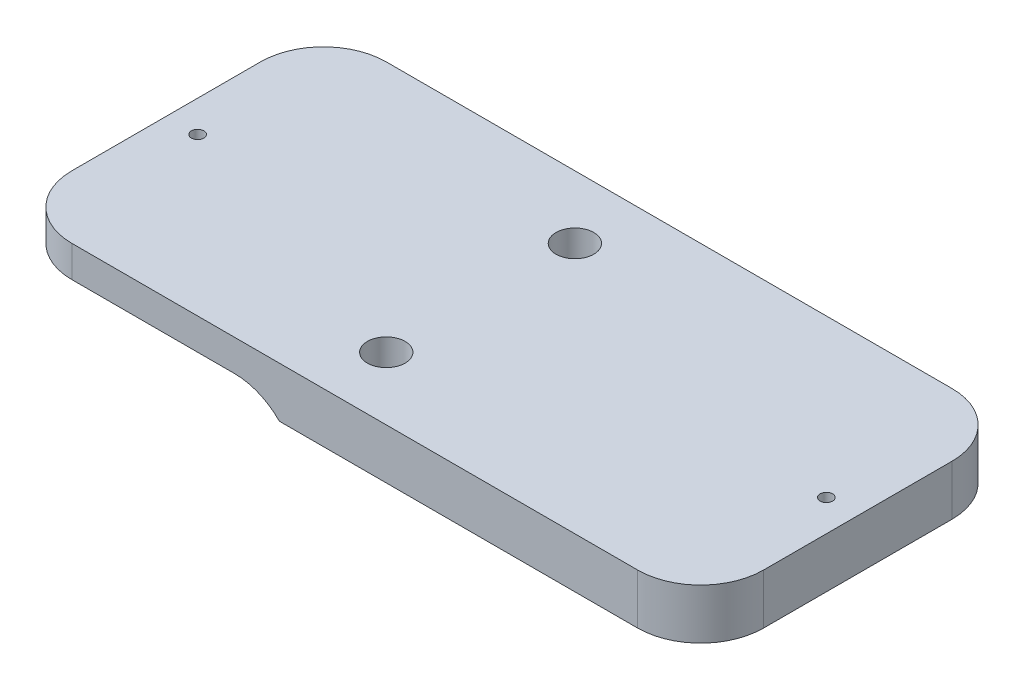
from build123d import *

# Parameters (mm, degrees)
SKETCH1_W           = 110
SKETCH1_H           = 50
SKETCH1_R           = 1.75
BOSS_EXTRUDE1_DEPTH = 8
SKETCH2_W           = 43
SKETCH2_H           = 50
CUT_EXTRUDE1_DEPTH  = 3
SKETCH3_R           = 3
CUT_EXTRUDE2_DEPTH  = 5
FILLET1_R           = 10
FILLET2_R           = 10
SKETCH4_R           = 1
CUT_EXTRUDE3_DEPTH  = 122.095004026


with BuildPart() as part:
    # Sketch1 → Boss-Extrude1 (new body)
    with BuildSketch(Plane(origin=(0, 0, 0), x_dir=(1, 0, 0), z_dir=(0, 1, 0))):
        with Locations((55, 25)):
            Rectangle(SKETCH1_W, SKETCH1_H)
        with Locations(Location((50, 40, 0), (0, 0, 270))):
            Circle(SKETCH1_R, mode=Mode.SUBTRACT)
        with Locations(Location((50, 10, 0), (0, 0, 270))):
            Circle(SKETCH1_R, mode=Mode.SUBTRACT)
    extrude(amount=BOSS_EXTRUDE1_DEPTH)

    # Sketch2 → Cut-Extrude1 (cut)
    with BuildSketch(Plane.XZ):
        with Locations((21.5, -25)):
            Rectangle(SKETCH2_W, SKETCH2_H)
    extrude(amount=-CUT_EXTRUDE1_DEPTH, mode=Mode.SUBTRACT)

    # Sketch3 → Cut-Extrude2 (cut)
    with BuildSketch(Plane(origin=(0, 8, 0), x_dir=(1, 0, 0), z_dir=(0, 1, 0))):
        with Locations(Location((50, 40, 0), (0, 0, 270))):
            Circle(SKETCH3_R)
        with Locations(Location((50, 10, 0), (0, 0, 270))):
            Circle(SKETCH3_R)
    extrude(amount=-CUT_EXTRUDE2_DEPTH, mode=Mode.SUBTRACT)

    # Fillet1
    # the kernel refuses this fillet: 10 mm, written as the material it adds along each edge
    with BuildSketch(Plane(origin=(43, 3, 0), x_dir=(-1, 0, 0), z_dir=(0, 0, -1))) as fillet1_piece_1:
        with BuildLine():
            CenterArc((7.141428429, -10), FILLET1_R, 90, 45.572995999)
            Line((0, -3), (-0.142828569, -2.86))
            ThreePointArc((-0.142828569, -2.86), (-0.2, -1.5), (-0.2, 0))
            Line((-0.2, 0), (0, 0.2))
            Line((0, 0.2), (7.141428429, 0.2))
            Line((7.141428429, 0.2), (7.141428429, 0))
        make_face()
    extrude(amount=50)

    # Fillet2
    fillet2_edges = [part.edges().sort_by_distance(p)[0] for p in [
        (0, 5.5, -50),
        (110, 4, -50),
        (110, 4, 0),
        (0, 5.5, 0),
    ]]
    fillet(fillet2_edges, radius=FILLET2_R)

    # Sketch4 → Cut-Extrude3 (cut, through all)
    with BuildSketch(Plane(origin=(0, 8, 0), x_dir=(1, 0, 0), z_dir=(0, 1, 0))):
        with Locations(Location((5, 25, 0), (0, 0, 270))):
            Circle(SKETCH4_R)
        with Locations(Location((105, 25, 0), (0, 0, 270))):
            Circle(SKETCH4_R)
    extrude(amount=-CUT_EXTRUDE3_DEPTH, mode=Mode.SUBTRACT)


solid = part.part
